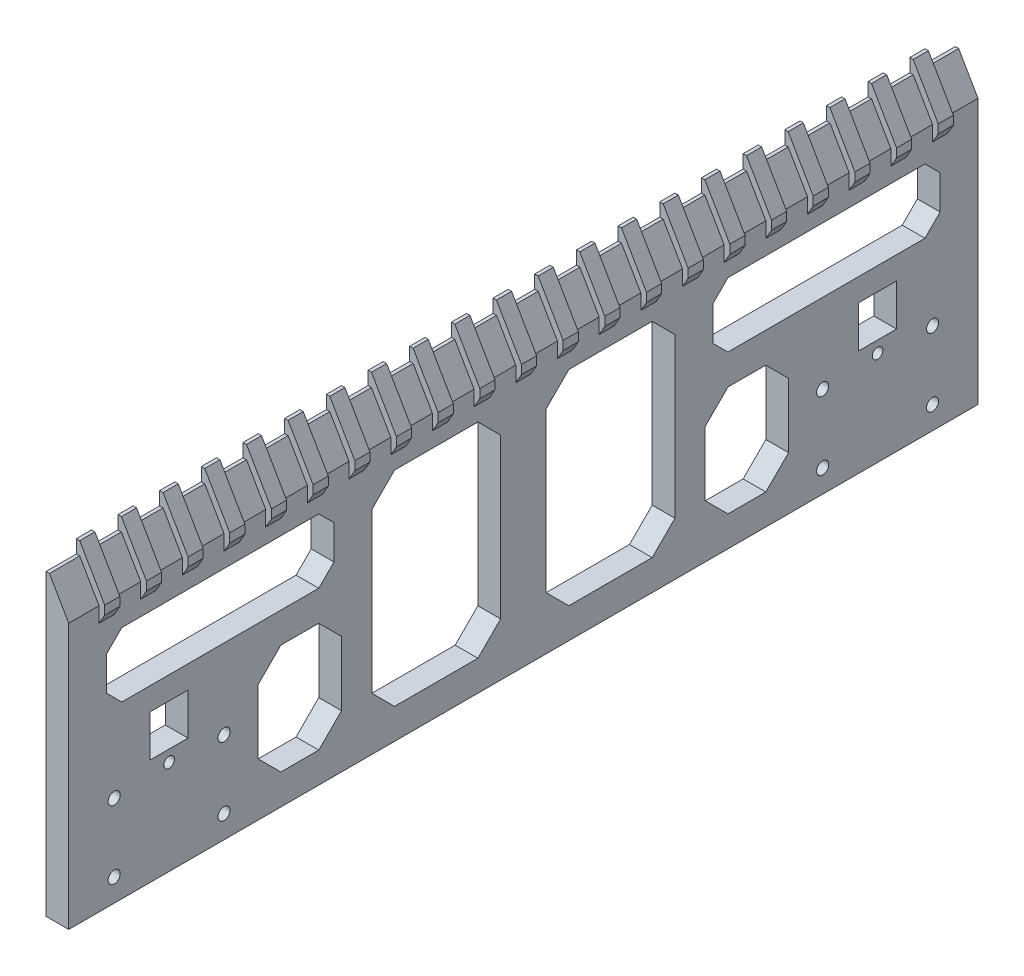
from build123d import *

# Parameters (mm, degrees)
SKETCH_1_W                  = 240
SKETCH_1_H                  = 70
EXTRUDE_1_DEPTH             = 6
CUT_EXTRUDE_2_DEPTH         = 251.071989635
EXTRUDE_2_DEPTH             = 240
EXTRUDE_3_DEPTH             = 2
PATTERN_LINEAR_1_COUNT      = 11
PATTERN_LINEAR_1_PITCH      = 11
PATTERN_LINEAR_1_COUNT_DIR2 = 11
PATTERN_LINEAR_1_PITCH_DIR2 = 11
HOLE_WIZARD_1_D             = 3.2
HOLE_WIZARD_1_CBORE_D       = 6
HOLE_WIZARD_1_CBORE_DEPTH   = 3.4
SKETCH_16_R                 = 1.4
CUT_EXTRUDE_3_DEPTH         = 10
SKETCH_17_W                 = 10
SKETCH_17_H                 = 11
CUT_EXTRUDE_4_DEPTH         = 251.112474699


with BuildPart() as part:
    # 草图1 → 凸台-拉伸1 (new body)
    with BuildSketch(Plane(origin=(0, 0, 0), x_dir=(0, 0, -1), z_dir=(1, 0, 0))):
        with Locations((120, -35)):
            Rectangle(SKETCH_1_W, SKETCH_1_H)
    extrude(amount=EXTRUDE_1_DEPTH)

    # 草图3 → 切除-拉伸2 (cut, through all)
    with BuildSketch(Plane(origin=(6, 0, 0), x_dir=(0, 0, -1), z_dir=(1, 0, 0))):
        Polygon((14, -8), (66, -8), (70, -12), (70, -21), (66, -25), (14, -25), (10, -21), (10, -12), align=None)
        Polygon((80, -14), (86, -8), (108, -8), (114, -14), (114, -56), (108, -62), (86, -62), (80, -56), align=None)
        Polygon((50, -56), (56, -62), (66, -62), (72, -56), (72, -39), (66, -33), (56, -33), (50, -39), align=None)
    cut_extrude_2 = extrude(amount=-CUT_EXTRUDE_2_DEPTH, mode=Mode.SUBTRACT)

    # 草图6 → 凸台-拉伸2 (add)
    with BuildSketch(Plane.XY):
        Polygon((6, 0), (0, 0), (0, 8.833459119), (0.9, 8.833459119), align=None)
    extrude(amount=-EXTRUDE_2_DEPTH)

    # 草图8 → 凸台-拉伸3 (add, symmetric)
    with BuildSketch(Plane.XY.offset(-120)):
        Polygon((0, 10.392304845), (0, 12.333459119), (0.9, 12.333459119), (7.5, 0.901923789), (7.5, -1.401923789), (6, -4), (6, 0), (0.9, 8.833459119), (0, 8.833459119), align=None)
    extrude_3 = extrude(amount=EXTRUDE_3_DEPTH, both=True)

    # 阵列(线性)1: Extrude 3 11 × 11
    with Locations(*[Vector(0, 0, 1) * (i * PATTERN_LINEAR_1_PITCH) + Vector(0, 0, -1) * (j * PATTERN_LINEAR_1_PITCH_DIR2) for i in range(PATTERN_LINEAR_1_COUNT) for j in range(PATTERN_LINEAR_1_COUNT_DIR2) if (i, j) != (0, 0)]):
        add(extrude_3)

    # 打孔尺寸(%根据)内六角圆柱头螺钉的类型1 (through all)
    with Locations(Plane.ZY):
        with Locations((-41, -46), (-12, -46), (-12, -64), (-41, -64)):
            hole_wizard_1 = CounterBoreHole(HOLE_WIZARD_1_D / 2, HOLE_WIZARD_1_CBORE_D / 2, HOLE_WIZARD_1_CBORE_DEPTH)

    # 草图16 → 切除-拉伸3 (cut)
    with BuildSketch(Plane.ZY):
        with Locations((-26.5, -45.023268437)):
            Circle(SKETCH_16_R)
    cut_extrude_3 = extrude(amount=-CUT_EXTRUDE_3_DEPTH, mode=Mode.SUBTRACT)

    # 镜向1: 打孔尺寸(%根据)内六角圆柱头螺钉的类型1 across plane
    add(hole_wizard_1.mirror(Plane.XY.offset(-120)), mode=Mode.SUBTRACT)

    # 镜向2: 切除-拉伸2, 切除-拉伸3 across plane
    add(cut_extrude_2.mirror(Plane.XY.offset(-120)), mode=Mode.SUBTRACT)
    add(cut_extrude_3.mirror(Plane.XY.offset(-120)), mode=Mode.SUBTRACT)

    # 草图17 → 切除-拉伸4 (cut, through all)
    with BuildSketch(Plane.ZY):
        with Locations((-26.5, -36.5)):
            Rectangle(SKETCH_17_W, SKETCH_17_H)
        with Locations((-213.5, -36.5)):
            Rectangle(SKETCH_17_W, SKETCH_17_H)
    extrude(amount=-CUT_EXTRUDE_4_DEPTH, mode=Mode.SUBTRACT)


solid = part.part
